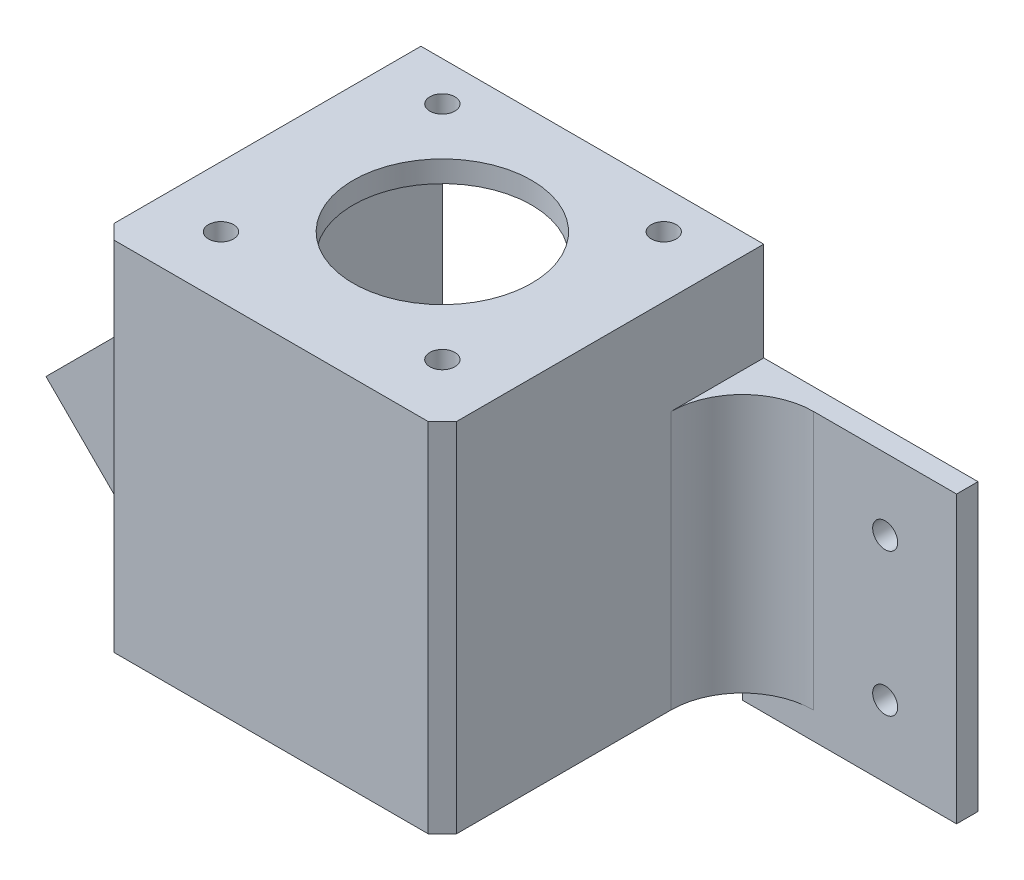
from build123d import *

# Parameters (mm, degrees)
SKETCH1_W           = 48
SKETCH1_H           = 45
BOSS_EXTRUDE1_DEPTH = 3
BOSS_EXTRUDE2_DEPTH = 47
SKETCH3_W           = 3
SKETCH3_H           = 40
BOSS_EXTRUDE3_DEPTH = 30
BOSS_EXTRUDE4_DEPTH = 3
FILLET1_R           = 10
CHAMFER1_SIZE       = 2
SKETCH5_R           = 1.75
SKETCH5_R_2         = 12.5
CUT_EXTRUDE1_DEPTH  = 118.578078301
SKETCH7_R           = 1.75
CUT_EXTRUDE2_DEPTH  = 123.525933977


with BuildPart() as part:
    # Sketch1 → Boss-Extrude1 (new body)
    with BuildSketch(Plane(origin=(0, 0, 0), x_dir=(1, 0, 0), z_dir=(0, 1, 0))):
        with Locations((0, -1.5)):
            Rectangle(SKETCH1_W, SKETCH1_H)
    extrude(amount=BOSS_EXTRUDE1_DEPTH)

    # Sketch2 → Boss-Extrude2 (add)
    with BuildSketch(Plane.XZ):
        Polygon((-21, 21), (21, 21), (21, -21), (24, -21), (24, 24), (-24, 24), (-24, -21), (-21, -21), align=None)
    extrude(amount=BOSS_EXTRUDE2_DEPTH)

    # Sketch3 → Boss-Extrude3 (add)
    with BuildSketch(Plane(origin=(24, 0, 0), x_dir=(0, 0, -1), z_dir=(1, 0, 0))):
        with Locations((19.5, -30.8)):
            Rectangle(SKETCH3_W, SKETCH3_H)
    extrude(amount=BOSS_EXTRUDE3_DEPTH)

    # Sketch4 → Boss-Extrude4 (add)
    with BuildSketch(Plane(origin=(0, 0, -21), x_dir=(-1, 0, 0), z_dir=(0, 0, -1))):
        Polygon((24, -10.8), (73.497474683, -60.297474683), (45.213203436, -88.581745931), (24, -67.368542495), align=None)
    extrude(amount=-BOSS_EXTRUDE4_DEPTH)

    # Fillet1
    fillet1_edges = [part.edges().sort_by_distance(p)[0] for p in [
        (-24, -28.9, -18),
        (24, -28.9, -18),
    ]]
    fillet(fillet1_edges, radius=FILLET1_R)

    # Chamfer1
    chamfer1_edges = [part.edges().sort_by_distance(p)[0] for p in [
        (-24, -22, 24),
        (24, -22, 24),
    ]]
    chamfer(chamfer1_edges, length=CHAMFER1_SIZE)

    # Sketch5 → Cut-Extrude1 (cut, through all)
    with BuildSketch(Plane.XZ):
        with Locations((-15.5, 15.5)):
            Circle(SKETCH5_R)
        with Locations((15.5, 15.5)):
            Circle(SKETCH5_R)
        with Locations((15.5, -15.5)):
            Circle(SKETCH5_R)
        with Locations((-15.5, -15.5)):
            Circle(SKETCH5_R)
        Circle(SKETCH5_R_2)
    extrude(amount=-CUT_EXTRUDE1_DEPTH, mode=Mode.SUBTRACT)

    # Sketch7 → Cut-Extrude2 (cut, through all)
    with BuildSketch(Plane.XY.offset(-18)):
        with Locations((44, -20.8)):
            Circle(SKETCH7_R)
        with Locations((44, -40.8)):
            Circle(SKETCH7_R)
        with Locations((-56.5520382, -57.494173824)):
            Circle(SKETCH7_R)
        with Locations((-42.409902577, -71.636309448)):
            Circle(SKETCH7_R)
    extrude(amount=-CUT_EXTRUDE2_DEPTH, mode=Mode.SUBTRACT)


solid = part.part
